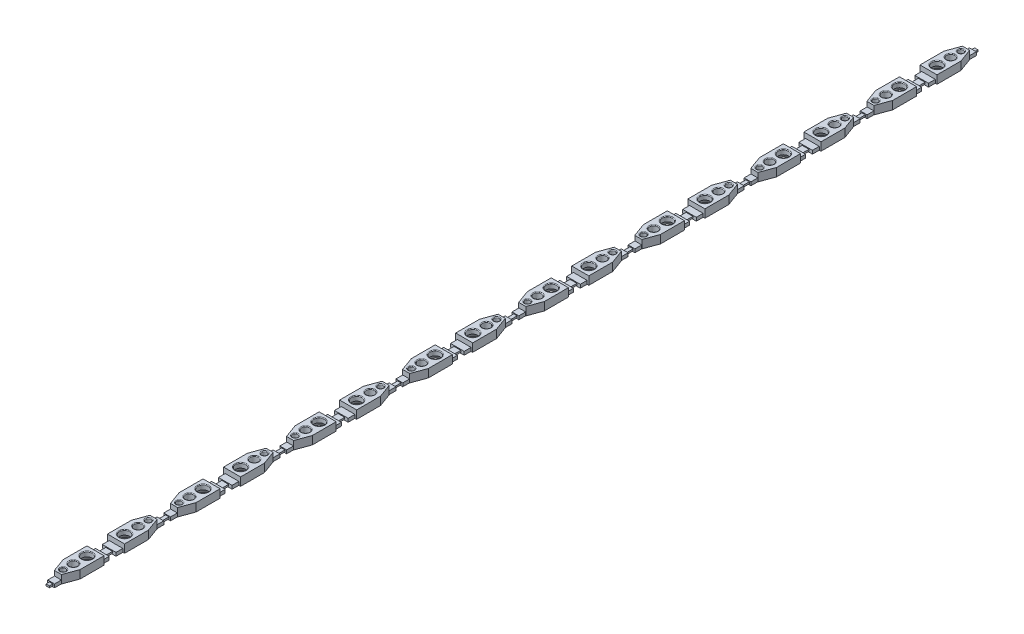
from build123d import *

# Parameters (mm, degrees)
SKETCH1_W           = 2.5
SKETCH1_H           = 6.5
BOSS_EXTRUDE1_DEPTH = 1.2
SKETCH2_R           = 0.6
SKETCH2_R_2         = 0.765
SKETCH2_R_3         = 0.4
CUT_EXTRUDE1_DEPTH  = 1.2
CHAMFER1_SIZE       = 3
CHAMFER1_SIZE2      = 1.091910703
CHAMFER2_SIZE       = 3
CHAMFER2_SIZE2      = 1.091910703
SKETCH3_W           = 2.5
SKETCH3_H           = 1.2
CUT_EXTRUDE2_DEPTH  = 1
CHAMFER3_SIZE       = 0.3
CHAMFER3_SIZE2      = 0.519615242
FILLET1_R           = 0.1
SKETCH4_W           = 1
SKETCH4_H           = 0.5
BOSS_EXTRUDE2_DEPTH = 1
SKETCH5_W           = 2
SKETCH5_H           = 0.5
BOSS_EXTRUDE3_DEPTH = 1
SKETCH6_W           = 0.5
SKETCH6_H           = 0.25
BOSS_EXTRUDE4_DEPTH = 0.5
SKETCH8_W           = 1
SKETCH8_H           = 0.25
BOSS_EXTRUDE6_DEPTH = 0.5


# Read off the part's stored shape, not the designer's step: Mirror2, Mirror4, Mirror6, Mirror7
with BuildPart() as part:
    # Sketch1 → Boss-Extrude1 (new body)
    with BuildSketch(Plane(origin=(0, 0, 0), x_dir=(1, 0, 0), z_dir=(0, 1, 0))):
        Rectangle(SKETCH1_W, SKETCH1_H)
    extrude(amount=BOSS_EXTRUDE1_DEPTH)

    # Sketch2 → Cut-Extrude1 (cut)
    with BuildSketch(Plane(origin=(0, 1.2, 0), x_dir=(1, 0, 0), z_dir=(0, 1, 0))):
        with Locations(Location((0, 0, 0), (0, 0, 270))):
            Circle(SKETCH2_R)
        with Locations(Location((0, -2, 0), (0, 0, 270))):
            Circle(SKETCH2_R_2)
        with Locations(Location((-0.001766606, 1.5, 0), (0, 0, 270))):
            Circle(SKETCH2_R_3)
    extrude(amount=-CUT_EXTRUDE1_DEPTH, mode=Mode.SUBTRACT)

    # Chamfer1
    chamfer1_edges = [part.edges().sort_by_distance(p)[0] for p in [
        (1.25, 0.6, -3.25),
    ]]
    chamfer1_side = [part.faces().sort_by_distance(p)[0] for p in [
        (1.25, 0.6, 0),
    ]]
    chamfer(chamfer1_edges, length=CHAMFER1_SIZE, length2=CHAMFER1_SIZE2, reference=chamfer1_side[0])

    # Chamfer2
    chamfer2_edges = [part.edges().sort_by_distance(p)[0] for p in [
        (-1.25, 0.6, -3.25),
    ]]
    chamfer2_side = [part.faces().sort_by_distance(p)[0] for p in [
        (-1.25, 0.6, 0),
    ]]
    chamfer(chamfer2_edges, length=CHAMFER2_SIZE, length2=CHAMFER2_SIZE2, reference=chamfer2_side[0])

    # Sketch3 → Cut-Extrude2 (cut)
    with BuildSketch(Plane(origin=(0, 0, -3.25), x_dir=(-1, 0, 0), z_dir=(0, 0, -1))):
        with Locations((0, 0.6)):
            Rectangle(SKETCH3_W, SKETCH3_H)
    extrude(amount=-CUT_EXTRUDE2_DEPTH, mode=Mode.SUBTRACT)

    # Chamfer3
    chamfer3_edges = [part.edges().sort_by_distance(p)[0] for p in [
        (0, 0, 1.235),
    ]]
    chamfer3_side = [part.faces().sort_by_distance(p)[0] for p in [
        (0.000100657, 0, 0.709259096),
    ]]
    chamfer(chamfer3_edges, length=CHAMFER3_SIZE, length2=CHAMFER3_SIZE2, reference=chamfer3_side[0])

    # Fillet1
    fillet1_edges = [part.edges().sort_by_distance(p)[0] for p in [
        (0, 0, -0.6),
        (0, 1.2, -0.6),
        (0, 1.2, 1.235),
        (-0.001766606, 0, -1.9),
        (-0.001766606, 1.2, -1.9),
    ]]
    fillet(fillet1_edges, radius=FILLET1_R)

    # Sketch4 → Boss-Extrude2 (add)
    with BuildSketch(Plane(origin=(0, 0, -2.25), x_dir=(-1, 0, 0), z_dir=(0, 0, -1))):
        with Locations((0, 0.250555681)):
            Rectangle(SKETCH4_W, SKETCH4_H)
    extrude(amount=BOSS_EXTRUDE2_DEPTH)

    # Sketch5 → Boss-Extrude3 (add)
    with BuildSketch(Plane.XY.offset(3.25)):
        with Locations((0, 0.252908482)):
            Rectangle(SKETCH5_W, SKETCH5_H)
    extrude(amount=BOSS_EXTRUDE3_DEPTH)

    # Sketch6 → Boss-Extrude4 (add)
    with BuildSketch(Plane(origin=(0, 0, -3.25), x_dir=(-1, 0, 0), z_dir=(0, 0, -1))):
        with Locations((0, 0.250555681)):
            Rectangle(SKETCH6_W, SKETCH6_H)
    extrude(amount=BOSS_EXTRUDE4_DEPTH)

    # Sketch8 → Boss-Extrude6 (add)
    with BuildSketch(Plane.XY.offset(4.25)):
        with Locations((0, 0.252908482)):
            Rectangle(SKETCH8_W, SKETCH8_H)
    extrude(amount=BOSS_EXTRUDE6_DEPTH)

    # Mirror2: part across plane


with BuildPart() as part_1:
    add(part.part)
    add(part.part.mirror(Plane(origin=(0, 0, 4.75), x_dir=(1, 0, 0), z_dir=(0, 0, -1))))

    # Mirror4: part across plane


with BuildPart() as part_2:
    add(part_1.part)
    add(part_1.part.mirror(Plane.XY.offset(13.25)))

    # Mirror6: part across plane


with BuildPart() as part_3:
    add(part_2.part)
    add(part_2.part.mirror(Plane.XY.offset(30.25)))

    # Mirror7: part across plane


with BuildPart() as part_4:
    add(part_3.part)
    add(part_3.part.mirror(Plane.XY.offset(64.25)))


solid = part_4.part
